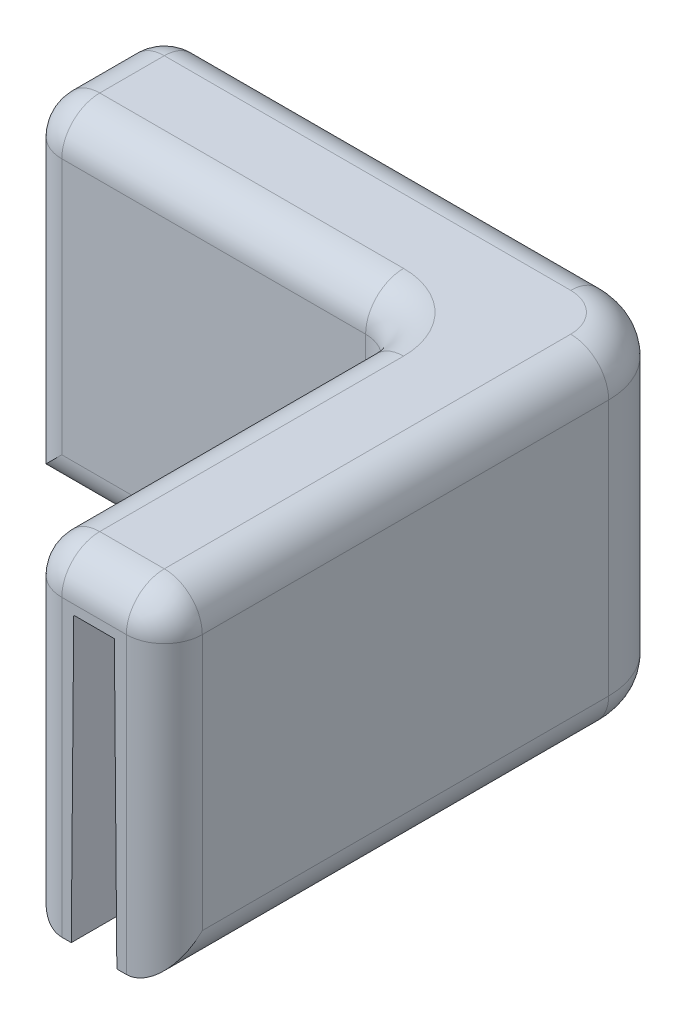
from build123d import *

# Parameters (mm, degrees)
BOSS_EXTRUDE1_DEPTH = 22.225
CUT_EXTRUDE1_DEPTH  = 19.05
CUT_EXTRUDE1_DRAFT  = -0.5
FILLET1_R           = 5.08
FILLET2_R           = 2.54


with BuildPart() as part:
    # Sketch1 → Boss-Extrude1 (new body)
    with BuildSketch(Plane(origin=(0, 0, 0), x_dir=(1, 0, 0), z_dir=(0, 1, 0))):
        Polygon((-34.798, 0), (0, 0), (0, -34.798), (-9.398, -34.798), (-9.398, -9.398), (-34.798, -9.398), align=None)
    extrude(amount=BOSS_EXTRUDE1_DEPTH)


with BuildPart() as cut_extrude1_tool:
    # Sketch2 → Cut-Extrude1 (with draft: the straight prism first)
    with BuildSketch(Plane.XZ):
        Polygon((-3.175, 40.346025657), (-6.223, 40.346025657), (-6.223, 6.223), (-37.911790098, 6.223), (-37.911790098, 3.175), (-3.175, 3.175), align=None)
    extrude(amount=-CUT_EXTRUDE1_DEPTH)
    # Cut-Extrude1: the draft: its side faces are tilted about the plane it starts from
    cut_extrude1_sides = [cut_extrude1_tool.faces().sort_by_distance(p)[0] for p in [
        (-4.699, 9.525, 40.346025657),
        (-6.223, 9.525, 23.284512829),
        (-22.067395049, 9.525, 6.223),
        (-37.911790098, 9.525, 4.699),
        (-20.543395049, 9.525, 3.175),
        (-3.175, 9.525, 21.760512829),
    ]]
    draft(cut_extrude1_sides, Plane.XZ, CUT_EXTRUDE1_DRAFT)


with BuildPart() as part_1:
    add(part.part)

    # Cut-Extrude1: cut by cut_extrude1_tool
    add(cut_extrude1_tool.part, mode=Mode.SUBTRACT)

    # Fillet1
    fillet1_edges = [part_1.edges().sort_by_distance(p)[0] for p in [
        (0, 11.1125, 0),
        (-6.139876584, 9.525, 6.139876584),
    ]]
    fillet(fillet1_edges, radius=FILLET1_R)

    # Fillet2
    # the kernel refuses this fillet: 2.54 mm, written as the material it adds along each edge
    with BuildSketch(Plane(origin=(-9.398, 0, 9.398), x_dir=(-1, 0, 0), z_dir=(0, 1, 0))) as fillet2_piece_1:
        with BuildLine():
            CenterArc((FILLET2_R, FILLET2_R), FILLET2_R, 180, 90)
            Line((0, FILLET2_R), (0, 0))
            Line((0, 0), (FILLET2_R, 0))
        make_face()
    extrude(amount=22.225)
    # the kernel refuses this fillet: 2.54 mm, written as the material it takes off along each edge
    with BuildSketch(Plane(origin=(-32.258, 19.685, 2.54), x_dir=(-1, 0, 0), z_dir=(0, 0, -1))) as fillet2_2_piece_1_section:
        Polygon((0, 0), (FILLET2_R, 0), (FILLET2_R, FILLET2_R), (0, FILLET2_R), align=None)
    fillet2_2_piece_1 = extrude(amount=FILLET2_R, mode=Mode.PRIVATE)
    fillet2_2_piece_1 = fillet2_2_piece_1 - Plane(origin=(-32.258, 19.685, 2.54), x_dir=(0.7071067811865475, -0.7071067811865475, 0), z_dir=(0, 0, -1)) * Sphere(FILLET2_R, mode=Mode.PRIVATE)
    add(fillet2_2_piece_1, mode=Mode.SUBTRACT)
    with BuildSketch(Plane(origin=(-2.54, 19.685, 32.258), x_dir=(1, 0, 0), z_dir=(0, 1, 0))) as fillet2_2_piece_2_section:
        Polygon((0, 0), (FILLET2_R, 0), (FILLET2_R, -FILLET2_R), (0, -FILLET2_R), align=None)
    fillet2_2_piece_2 = extrude(amount=FILLET2_R, mode=Mode.PRIVATE)
    fillet2_2_piece_2 = fillet2_2_piece_2 - Plane(origin=(-2.54, 19.685, 32.258), x_dir=(-0.7071067811865478, 0, -0.7071067811865471), z_dir=(0, 1, 0)) * Sphere(FILLET2_R, mode=Mode.PRIVATE)
    add(fillet2_2_piece_2, mode=Mode.SUBTRACT)
    with BuildSketch(Plane(origin=(-6.858, 19.685, 32.258), x_dir=(-1, 0, 0), z_dir=(0, 1, 0))) as fillet2_2_piece_3_section:
        Polygon((0, 0), (FILLET2_R, 0), (FILLET2_R, FILLET2_R), (0, FILLET2_R), align=None)
    fillet2_2_piece_3 = extrude(amount=FILLET2_R, mode=Mode.PRIVATE)
    fillet2_2_piece_3 = fillet2_2_piece_3 - Plane(origin=(-6.858, 19.685, 32.258), x_dir=(0.7071067811865471, 0, -0.7071067811865479), z_dir=(0, 1, 0)) * Sphere(FILLET2_R, mode=Mode.PRIVATE)
    add(fillet2_2_piece_3, mode=Mode.SUBTRACT)
    with BuildSketch(Plane(origin=(-32.258, 19.685, 6.858), x_dir=(0, 0, 1), z_dir=(-1, 0, 0))) as fillet2_2_piece_4_section:
        Polygon((0, 0), (FILLET2_R, 0), (FILLET2_R, FILLET2_R), (0, FILLET2_R), align=None)
    fillet2_2_piece_4 = extrude(amount=FILLET2_R, mode=Mode.PRIVATE)
    fillet2_2_piece_4 = fillet2_2_piece_4 - Plane(origin=(-32.258, 19.685, 6.858), x_dir=(0, -0.7071067811865475, -0.7071067811865475), z_dir=(-1, 0, 0)) * Sphere(FILLET2_R, mode=Mode.PRIVATE)
    add(fillet2_2_piece_4, mode=Mode.SUBTRACT)
    with BuildSketch(Plane(origin=(-34.798, -6.35, 0), x_dir=(1, 0, 0), z_dir=(0, 1, 0)), Plane(origin=(-34.798, -6.35, 9.398), x_dir=(0, 0, -1), z_dir=(0, 1, 0))) as fillet2_2_piece_5:
        with BuildLine():
            CenterArc((FILLET2_R, -FILLET2_R), FILLET2_R, 90, 90)
            Line((0, -FILLET2_R), (0, 0))
            Line((0, 0), (FILLET2_R, 0))
        make_face()
    extrude(amount=26.035, mode=Mode.SUBTRACT)
    with BuildSketch(Plane(origin=(0, -6.35, 34.798), x_dir=(0, 0, -1), z_dir=(0, 1, 0)), Plane(origin=(-9.398, -6.35, 34.798), x_dir=(1, 0, 0), z_dir=(0, 1, 0))) as fillet2_2_piece_6:
        with BuildLine():
            CenterArc((FILLET2_R, FILLET2_R), FILLET2_R, 180, 90)
            Line((0, FILLET2_R), (0, 0))
            Line((0, 0), (FILLET2_R, 0))
        make_face()
    extrude(amount=26.035, mode=Mode.SUBTRACT)
    with BuildSketch(Plane(origin=(-9.398, 22.225, 32.258), x_dir=(1, 0, 0), z_dir=(0, 0, -1)), Plane(origin=(-11.938, 22.225, 9.398), x_dir=(0, 0, -1), z_dir=(-1, 0, 0))) as fillet2_2_piece_7:
        with BuildLine():
            CenterArc((FILLET2_R, FILLET2_R), FILLET2_R, 180, 90)
            Line((0, FILLET2_R), (0, 0))
            Line((0, 0), (FILLET2_R, 0))
        make_face()
    extrude(amount=20.32, mode=Mode.SUBTRACT)
    with BuildSketch(Plane(origin=(-2.54, 22.225, 34.798), x_dir=(0, 0, -1), z_dir=(-1, 0, 0))) as fillet2_2_piece_8:
        with BuildLine():
            CenterArc((FILLET2_R, FILLET2_R), FILLET2_R, 180, 90)
            Line((0, FILLET2_R), (0, 0))
            Line((0, 0), (FILLET2_R, 0))
        make_face()
    extrude(amount=4.318, mode=Mode.SUBTRACT)
    with BuildSketch(Plane(origin=(0, 22.225, 5.08), x_dir=(-1, 0, 0), z_dir=(0, 0, 1))) as fillet2_2_piece_9:
        with BuildLine():
            CenterArc((FILLET2_R, FILLET2_R), FILLET2_R, 180, 90)
            Line((0, FILLET2_R), (0, 0))
            Line((0, 0), (FILLET2_R, 0))
        make_face()
    extrude(amount=27.178, mode=Mode.SUBTRACT)
    with BuildSketch(Plane(origin=(-41.148, 0, 0), x_dir=(0, 1, 0), z_dir=(1, 0, 0))) as fillet2_2_piece_10:
        with BuildLine():
            CenterArc((FILLET2_R, FILLET2_R), FILLET2_R, 180, 90)
            Line((0, FILLET2_R), (0, 0))
            Line((0, 0), (FILLET2_R, 0))
        make_face()
    extrude(amount=36.068, mode=Mode.SUBTRACT)
    with BuildSketch(Plane(origin=(-32.258, 22.225, 0), x_dir=(0, -1, 0), z_dir=(1, 0, 0))) as fillet2_2_piece_11:
        with BuildLine():
            CenterArc((FILLET2_R, -FILLET2_R), FILLET2_R, 90, 90)
            Line((0, -FILLET2_R), (0, 0))
            Line((0, 0), (FILLET2_R, 0))
        make_face()
    extrude(amount=27.178, mode=Mode.SUBTRACT)
    with BuildSketch(Plane(origin=(-34.798, 22.225, 6.858), x_dir=(0, -1, 0), z_dir=(0, 0, -1))) as fillet2_2_piece_12:
        with BuildLine():
            CenterArc((FILLET2_R, -FILLET2_R), FILLET2_R, 90, 90)
            Line((0, -FILLET2_R), (0, 0))
            Line((0, 0), (FILLET2_R, 0))
        make_face()
    extrude(amount=4.318, mode=Mode.SUBTRACT)
    with BuildSketch(Plane(origin=(-5.08, 0, 5.08), x_dir=(0, 0, -1), z_dir=(-1, 0, 0))) as fillet2_2_piece_13:
        with BuildLine():
            CenterArc((5.08 - FILLET2_R, -FILLET2_R), FILLET2_R, 0, 90)
            Line((5.08, -FILLET2_R), (5.08, 0))
            Line((5.08, 0), (5.08 - FILLET2_R, 0))
        make_face()
    revolve(axis=Axis((-5.08, 0, 5.08), (0, -1, 0)), revolution_arc=90, mode=Mode.SUBTRACT)
    with BuildSketch(Plane(origin=(-5.08, 22.225, 5.08), x_dir=(0, 0, -1), z_dir=(-1, 0, 0))) as fillet2_2_piece_14:
        with BuildLine():
            CenterArc((5.08 - FILLET2_R, FILLET2_R), FILLET2_R, 270, 90)
            Line((5.08 - FILLET2_R, 0), (5.08, 0))
            Line((5.08, 0), (5.08, FILLET2_R))
        make_face()
    revolve(axis=Axis((-5.08, 22.225, 5.08), (0, -1, 0)), revolution_arc=90, mode=Mode.SUBTRACT)
    with BuildSketch(Plane(origin=(0, 0, 5.08), x_dir=(-1, 0, 0), z_dir=(0, 0, 1))) as fillet2_2_piece_15:
        with BuildLine():
            CenterArc((FILLET2_R, -FILLET2_R), FILLET2_R, 90, 90)
            Line((0, -FILLET2_R), (0, 0))
            Line((0, 0), (FILLET2_R, 0))
        make_face()
    extrude(amount=36.068, mode=Mode.SUBTRACT)
    with BuildSketch(Plane(origin=(-9.398, 0, 41.148), x_dir=(1, 0, 0), z_dir=(0, 0, -1)), Plane(origin=(-11.938, 0, 9.398), x_dir=(0, 0, -1), z_dir=(-1, 0, 0))) as fillet2_2_piece_16:
        with BuildLine():
            CenterArc((FILLET2_R, -FILLET2_R), FILLET2_R, 90, 90)
            Line((0, -FILLET2_R), (0, 0))
            Line((0, 0), (FILLET2_R, 0))
        make_face()
    extrude(amount=29.21, mode=Mode.SUBTRACT)
    with BuildSketch(Plane(origin=(-11.938, 22.225, 11.938), x_dir=(0, 0, -1), z_dir=(-1, 0, 0))) as fillet2_2_piece_17:
        with BuildLine():
            CenterArc((2.54 + FILLET2_R, FILLET2_R), FILLET2_R, 180, 90)
            Line((2.54, FILLET2_R), (2.54, 0))
            Line((2.54, 0), (2.54 + FILLET2_R, 0))
        make_face()
    revolve(axis=Axis((-11.938, 22.225, 11.938), (0, -1, 0)), revolution_arc=90, mode=Mode.SUBTRACT)
    with BuildSketch(Plane(origin=(-11.938, 0, 11.938), x_dir=(0, 0, -1), z_dir=(-1, 0, 0))) as fillet2_2_piece_18:
        with BuildLine():
            CenterArc((2.54 + FILLET2_R, -FILLET2_R), FILLET2_R, 90, 90)
            Line((2.54, -FILLET2_R), (2.54, 0))
            Line((2.54, 0), (2.54 + FILLET2_R, 0))
        make_face()
    revolve(axis=Axis((-11.938, 0, 11.938), (0, -1, 0)), revolution_arc=90, mode=Mode.SUBTRACT)


solid = part_1.part
